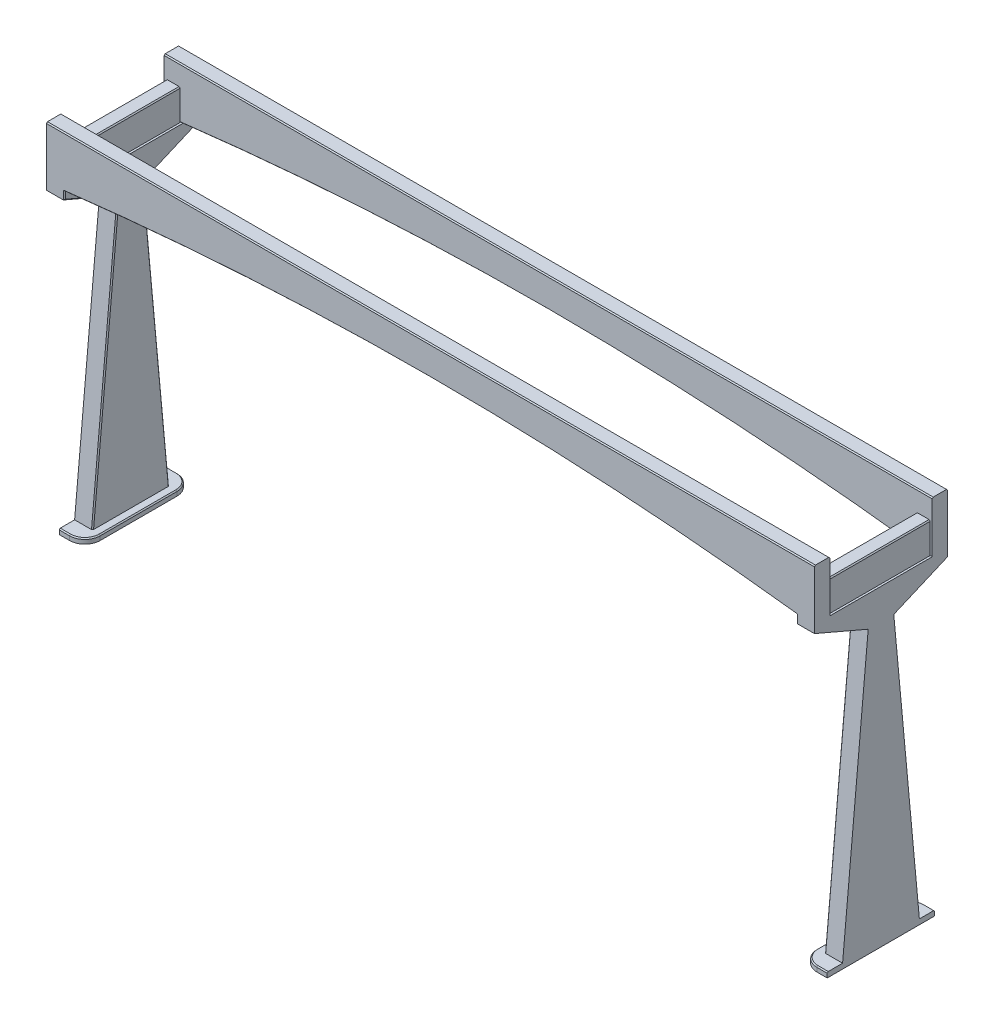
from build123d import *

# Parameters (mm, degrees)
BOSS_EXTRUDE1_DEPTH      = 30
SKETCH2_W                = 26.926999998
SKETCH2_H                = 60
BOSS_EXTRUDE2_DEPTH      = 200
BOSS_EXTRUDE3_START      = 30
BOSS_EXTRUDE3_DEPTH      = 30
BOSS_EXTRUDE4_DEPTH      = 4.0365
BOSS_EXTRUDE4_DEPTH_BACK = 30.9635
BOSS_EXTRUDE5_DEPTH      = 10
FILLET1_R                = 30
SKETCH7_W                = 260
SKETCH7_H                = 710
CUT_EXTRUDE1_DEPTH       = 1059.06427026
CHAMFER1_SIZE            = 2
CHAMFER2_SIZE            = 2
CHAMFER3_SIZE            = 2
CHAMFER4_SIZE            = 2
CHAMFER6_SIZE            = 2


with BuildPart() as part:
    # Sketch1 → Boss-Extrude1 (new body)
    with BuildSketch(Plane.XY):
        with BuildLine():
            Line((0, 0), (1500, 0))
            Line((1500, 0), (1500, -100))
            Line((1500, -100), (1465, -100))
            ThreePointArc((1465, -100), (750, -57.245588357), (35, -100))
            Line((35, -100), (0, -100))
            Line((0, -100), (0, 0))
        make_face()
    extrude(amount=BOSS_EXTRUDE1_DEPTH)

    # Sketch2 → Boss-Extrude2 (add)
    with BuildSketch(Plane(origin=(0, 0, 0), x_dir=(-1, 0, 0), z_dir=(0, 0, -1))):
        with Locations((-1482.5, -70)):
            Rectangle(SKETCH2_W, SKETCH2_H)
        with Locations((-17.5, -70)):
            Rectangle(SKETCH2_W, SKETCH2_H)
    extrude(amount=BOSS_EXTRUDE2_DEPTH)

    # Sketch3 → Boss-Extrude3 (add)
    with BuildSketch(Plane(origin=(0, 0, -200), x_dir=(-1, 0, 0), z_dir=(0, 0, -1)).offset(BOSS_EXTRUDE3_START)):
        with BuildLine():
            Line((0, -100), (0, 0))
            Line((0, 0), (-1500, 0))
            Line((-1500, 0), (-1500, -100))
            Line((-1500, -100), (-1465, -100))
            ThreePointArc((-1465, -100), (-750, -57.245588357), (-35, -100))
            Line((-35, -100), (0, -100))
        make_face()
    extrude(amount=-BOSS_EXTRUDE3_DEPTH)

    # Sketch5 → Boss-Extrude4 (add, two sides: drawn at the far end of the back side and taken through both)
    with BuildSketch(Plane.ZY.offset(-4.036500001).offset(-BOSS_EXTRUDE4_DEPTH_BACK)):
        Polygon((-200, -100), (0, -100), (30, -100), (30, -115), (-75, -160), (-25, -700), (-100, -700), (-175, -700), (-125, -160), (-230, -115), (-230, -100), align=None)
    extrude(amount=BOSS_EXTRUDE4_DEPTH + BOSS_EXTRUDE4_DEPTH_BACK)

    # Sketch6 → Boss-Extrude5 (add)
    with BuildSketch(Plane.XZ.offset(700)):
        Polygon((0, -25), (0, 5), (50, 5), (50, -205), (0, -205), (0, -175), align=None)
    extrude(amount=BOSS_EXTRUDE5_DEPTH)

    # Fillet1
    fillet1_edges = [part.edges().sort_by_distance(p)[0] for p in [
        (50, -705, -205),
        (50, -705, 5),
    ]]
    fillet(fillet1_edges, radius=FILLET1_R)

    # Sketch7 → Cut-Extrude1 (cut, through all)
    with BuildSketch(Plane(origin=(750, 0, 0), x_dir=(0, 0, -1), z_dir=(1, 0, 0))):
        with Locations((100, -355)):
            Rectangle(SKETCH7_W, SKETCH7_H)
    extrude(amount=CUT_EXTRUDE1_DEPTH, mode=Mode.SUBTRACT)

    # Mirror2: part across plane


with BuildPart() as part_1:
    add(part.part)
    add(part.part.mirror(Plane(origin=(750, 0, 0), x_dir=(0, 0, 1), z_dir=(1, 0, 0))))

    # Chamfer1
    chamfer1_edges = [part_1.edges().sort_by_distance(p)[0] for p in [
        (750, 0, 30),
        (750, 0, 0),
        (750, 0, -200),
        (750, 0, -230),
    ]]
    chamfer(chamfer1_edges, length=CHAMFER1_SIZE)

    # Chamfer2
    chamfer2_edges = [part_1.edges().sort_by_distance(p)[0] for p in [
        (1495.963499999, -40, -100),
        (1469.036500001, -40, -100),
        (4.036500001, -40, -100),
        (30.963499999, -40, -100),
    ]]
    chamfer(chamfer2_edges, length=CHAMFER2_SIZE)

    # Chamfer3
    chamfer3_edges = [part_1.edges().sort_by_distance(p)[0] for p in [
        (1464.999999999, -107.5, -230),
        (1464.999999999, -137.5, -177.5),
        (1464.999999999, -430, -150),
        (1464.999999999, -430, -50),
        (1464.999999999, -137.5, -22.5),
        (1464.999999999, -107.5, 30),
        (35.000000001, -107.5, 30),
        (35.000000001, -137.5, -22.5),
        (35.000000001, -430, -50),
        (35.000000001, -430, -150),
        (35.000000001, -137.5, -177.5),
        (35.000000001, -107.5, -230),
    ]]
    chamfer(chamfer3_edges, length=CHAMFER3_SIZE)

    # Chamfer4
    chamfer4_edges = [part_1.edges().sort_by_distance(p)[0] for p in [
        (50, -700, -100),
        (10, -700, 5),
        (41.213203436, -700, -3.786796564),
        (41.213203436, -700, -196.213203436),
        (1450, -700, -100),
        (1490, -700, 5),
        (1490, -700, -205),
        (1458.786796564, -700, -196.213203436),
        (1458.786796564, -700, -3.786796564),
        (10, -700, -205),
    ]]
    chamfer(chamfer4_edges, length=CHAMFER4_SIZE)

    # Chamfer6
    # the kernel refuses this chamfer: 2 mm, written as the material it takes off along each edge
    with BuildSketch(Plane(origin=(750, -6057.245588357, 30), x_dir=(0.1203510488799101, 0.9927313962162704, 0), z_dir=(0.9927313962162704, -0.1203510488799101, 0))) as chamfer6_piece_1_section:
        Polygon((6000 + CHAMFER6_SIZE, 0), (6000, -CHAMFER6_SIZE), (6000, 0), align=None)
    chamfer6_piece_1 = revolve(axis=Axis((750, -6057.245588357, 30), (0, 0, 1)), revolution_arc=13.824726066, mode=Mode.PRIVATE)
    chamfer6_piece_1 = split(chamfer6_piece_1, bisect_by=Plane(origin=(1466.125003015, -99.334691053, 29.125003016), z_dir=(-0.7071067811865476, 0, 0.7071067811865476)), keep=Keep.TOP, mode=Mode.PRIVATE)
    chamfer6_piece_1 = split(chamfer6_piece_1, bisect_by=Plane(origin=(749.625001683, -99.334691053, -686.625001682), z_dir=(0.7071067811865476, 0, 0.7071067811865476)), keep=Keep.TOP, mode=Mode.PRIVATE)
    add(chamfer6_piece_1, mode=Mode.SUBTRACT)
    with BuildSketch(Plane(origin=(750, -6057.245588357, -200), x_dir=(-0.12001774996908876, 0.9927717460183672, 0), z_dir=(-0.9927717460183672, -0.12001774996908876, 0))) as chamfer6_piece_2_section:
        Polygon((6000 + CHAMFER6_SIZE, 0), (6000, CHAMFER6_SIZE), (6000, 0), align=None)
    chamfer6_piece_2 = revolve(axis=Axis((750, -6057.245588357, -200), (0, 0, -1)), revolution_arc=13.786253962, mode=Mode.PRIVATE)
    chamfer6_piece_2 = split(chamfer6_piece_2, bisect_by=Plane(origin=(33.165042668, -100, -200.593649662), z_dir=(0, 1, 0)), keep=Keep.TOP, mode=Mode.PRIVATE)
    chamfer6_piece_2 = split(chamfer6_piece_2, bisect_by=Plane(origin=(1469.036500001, -99.402070314, -200.593649662), z_dir=(-1, 0, 0)), keep=Keep.TOP, mode=Mode.PRIVATE)
    chamfer6_piece_2 = split(chamfer6_piece_2, bisect_by=Plane(origin=(30.963499999, -99.402070314, -200.593649662), z_dir=(1, 0, 0)), keep=Keep.TOP, mode=Mode.PRIVATE)
    add(chamfer6_piece_2, mode=Mode.SUBTRACT)
    with BuildSketch(Plane(origin=(750, -6057.245588357, 0), x_dir=(0.12001774996908958, 0.9927717460183672, 0), z_dir=(0.9927717460183672, -0.12001774996908958, 0))) as chamfer6_piece_3_section:
        Polygon((6000 + CHAMFER6_SIZE, 0), (6000, CHAMFER6_SIZE), (6000, 0), align=None)
    chamfer6_piece_3 = revolve(axis=Axis((750, -6057.245588357, 0), (0, 0, 1)), revolution_arc=13.786253962, mode=Mode.PRIVATE)
    chamfer6_piece_3 = split(chamfer6_piece_3, bisect_by=Plane(origin=(1466.834957332, -100, 0.593649662), z_dir=(0, 1, 0)), keep=Keep.TOP, mode=Mode.PRIVATE)
    chamfer6_piece_3 = split(chamfer6_piece_3, bisect_by=Plane(origin=(1469.036500001, -99.402070314, 0.593649662), z_dir=(-1, 0, 0)), keep=Keep.TOP, mode=Mode.PRIVATE)
    chamfer6_piece_3 = split(chamfer6_piece_3, bisect_by=Plane(origin=(30.963499999, -99.402070314, 0.593649662), z_dir=(1, 0, 0)), keep=Keep.TOP, mode=Mode.PRIVATE)
    add(chamfer6_piece_3, mode=Mode.SUBTRACT)
    with BuildSketch(Plane(origin=(750, -6057.245588357, -230), x_dir=(-0.12035104887990915, 0.9927313962162705, 0), z_dir=(-0.9927313962162705, -0.12035104887990915, 0))) as chamfer6_piece_4_section:
        Polygon((6000 + CHAMFER6_SIZE, 0), (6000, -CHAMFER6_SIZE), (6000, 0), align=None)
    chamfer6_piece_4 = revolve(axis=Axis((750, -6057.245588357, -230), (0, 0, -1)), revolution_arc=13.824726066, mode=Mode.PRIVATE)
    chamfer6_piece_4 = split(chamfer6_piece_4, bisect_by=Plane(origin=(750.374998317, -99.334691053, 486.625001682), z_dir=(-0.7071067811865476, 0, -0.7071067811865476)), keep=Keep.TOP, mode=Mode.PRIVATE)
    chamfer6_piece_4 = split(chamfer6_piece_4, bisect_by=Plane(origin=(33.874996985, -99.334691053, -229.125003016), z_dir=(0.7071067811865476, 0, -0.7071067811865476)), keep=Keep.TOP, mode=Mode.PRIVATE)
    add(chamfer6_piece_4, mode=Mode.SUBTRACT)


solid = part_1.part
